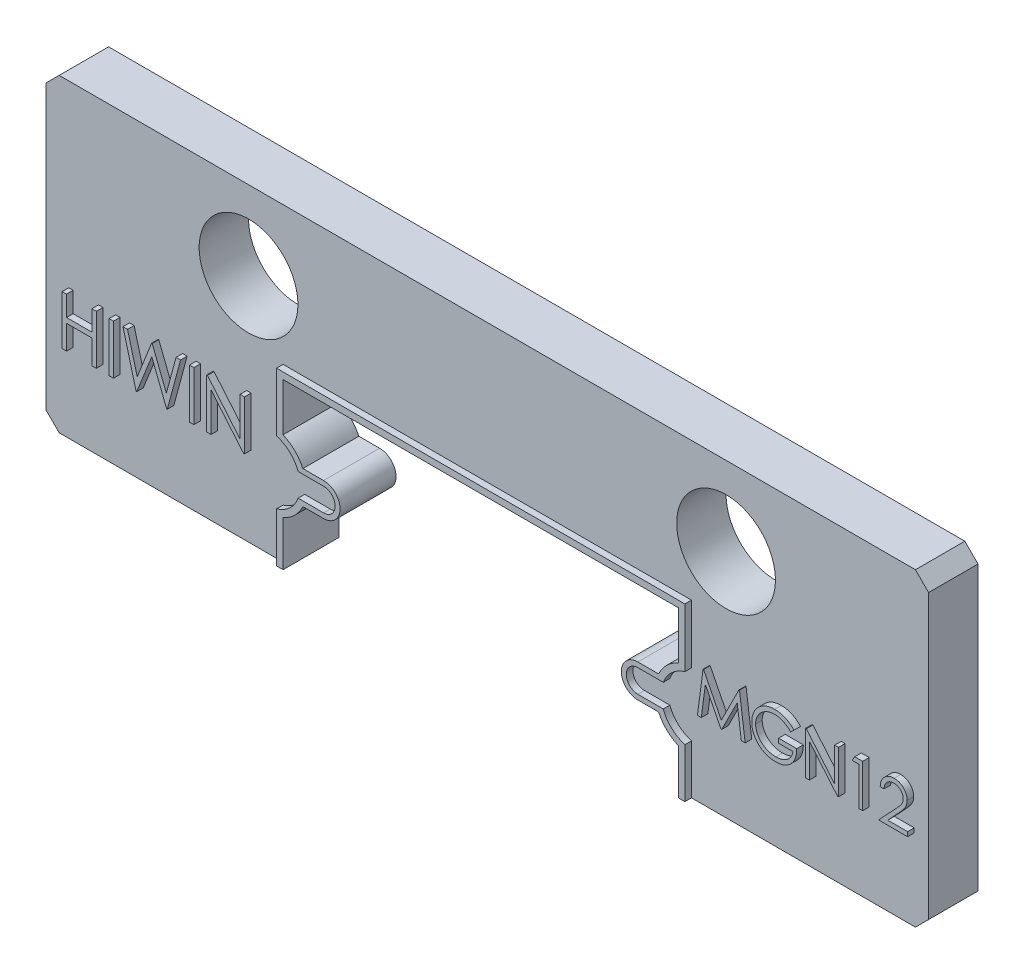
from build123d import *

# Parameters (mm, degrees)
BOSS_EXTRUDE1_DEPTH = 1.5
SKETCH2_R           = 1.5
CUT_EXTRUDE1_DEPTH  = 15.279355728
SKETCH3_W           = 0.134615385
SKETCH3_H           = 1.5
SKETCH3_W_2         = 0.134615384
BOSS_EXTRUDE2_DEPTH = 0.2
BOSS_EXTRUDE3_START = 0.2
BOSS_EXTRUDE3_DEPTH = 0.2


with BuildPart() as part:
    # Sketch1 → Boss-Extrude1 (new body)
    with BuildSketch(Plane.XY):
        with BuildLine():
            Line((-13, -4.7), (-6, -4.7))
            Line((-6, -4.7), (-6, -3.328898526))
            ThreePointArc((-6, -3.328898526), (-5.646338178, -3.089180762), (-5.400138898, -2.74))
            Line((-5.400138898, -2.74), (-4.77, -2.74))
            ThreePointArc((-4.77, -2.74), (-4.27, -2.24), (-4.77, -1.74))
            Line((-4.77, -1.74), (-5.400138898, -1.74))
            ThreePointArc((-5.400138898, -1.74), (-5.646338178, -1.390819238), (-6, -1.151101474))
            Line((-6, -1.151101474), (-6, 0.3))
            Line((-6, 0.3), (6, 0.3))
            Line((6, 0.3), (6, -1.151101474))
            ThreePointArc((6, -1.151101474), (5.646338178, -1.390819238), (5.400138898, -1.74))
            Line((5.400138898, -1.74), (4.77, -1.74))
            ThreePointArc((4.77, -1.74), (4.27, -2.24), (4.77, -2.74))
            Line((4.77, -2.74), (5.400138898, -2.74))
            ThreePointArc((5.400138898, -2.74), (5.646338178, -3.089180762), (6, -3.328898526))
            Line((6, -3.328898526), (6, -4.7))
            Line((6, -4.7), (13, -4.7))
            Line((13, -4.7), (13.4, -4.3))
            Line((13.4, -4.3), (13.4, 4.3))
            Line((13.4, 4.3), (13, 4.7))
            Line((13, 4.7), (-13, 4.7))
            Line((-13, 4.7), (-13.4, 4.3))
            Line((-13.4, 4.3), (-13.4, -4.3))
            Line((-13.4, -4.3), (-13, -4.7))
        make_face()
    extrude(amount=-BOSS_EXTRUDE1_DEPTH)

    # Sketch2 → Cut-Extrude1 (cut, through all)
    with BuildSketch(Plane.XY):
        with Locations((-7.25, 2.3)):
            Circle(SKETCH2_R)
        with Locations((7.25, 2.3)):
            Circle(SKETCH2_R)
    extrude(amount=-CUT_EXTRUDE1_DEPTH, mode=Mode.SUBTRACT)

    # Sketch3 → Boss-Extrude2 (add)
    with BuildSketch(Plane.XY):
        Polygon((-8.324615385, -2.24), (-8.324615385, -0.74), (-8.296370192, -0.74), (-7.305384615, -1.920588942), (-7.305384615, -0.74), (-7.170769231, -0.74), (-7.170769231, -2.24), (-7.201418269, -2.24), (-8.19, -1.062115385), (-8.19, -2.24), align=None)
        with Locations((-8.776538462, -1.49)):
            Rectangle(SKETCH3_W, SKETCH3_H)
        Polygon((-10.863076923, -0.74), (-10.723954327, -0.74), (-10.430384615, -1.840060096), (-9.993786058, -0.74), (-9.974254808, -0.74), (-9.545769231, -1.832548077), (-9.250697115, -0.74), (-9.113076923, -0.74), (-9.517524038, -2.24), (-9.536754808, -2.24), (-9.988076923, -1.092764423), (-10.444807692, -2.24), (-10.464038462, -2.24), align=None)
        with Locations((-11.218846154, -1.49)):
            Rectangle(SKETCH3_W_2, SKETCH3_H)
        Polygon((-12.709230769, -0.74), (-12.574615385, -0.74), (-12.574615385, -1.355384615), (-11.805384615, -1.355384615), (-11.805384615, -0.74), (-11.670769231, -0.74), (-11.670769231, -2.24), (-11.805384615, -2.24), (-11.805384615, -1.509230769), (-12.574615385, -1.509230769), (-12.574615385, -2.24), (-12.709230769, -2.24), align=None)
        Polygon((6.58, -2.24), (6.751614583, -0.94), (6.76828125, -0.94), (7.305, -2.006666667), (7.840416667, -0.94), (7.85734375, -0.94), (8.03, -2.24), (7.9128125, -2.24), (7.788333333, -1.304583333), (7.3190625, -2.24), (7.292760417, -2.24), (6.821666667, -1.3025), (6.697447917, -2.24), align=None)
        with BuildLine():
            Line((9.513333333, -1.161875), (9.413333333, -1.256666667))
            add(Edge.make_bspline(
                [(9.413333333, -1.256666667), (9.395237746, -1.239643775), (9.359478072, -1.206003911), (9.301178553, -1.16235697), (9.240352061, -1.124966704), (9.17731599, -1.094544388), (9.113631385, -1.070270506), (9.050143553, -1.052988625), (8.987503721, -1.041967397), (8.945841612, -1.040649431), (8.9253125, -1.04)],
                knots=[0, 0, 0, 0, 1.08915593, 2.152340314, 3.188132944, 4.216796309, 5.218260357, 6.173443236, 7.099959455, 8, 8, 8, 8], degree=3))
            add(Edge.make_bspline(
                [(8.9253125, -1.04), (8.912715611, -1.040153625), (8.887554505, -1.040460477), (8.85018064, -1.0443769), (8.813198746, -1.050009563), (8.776678636, -1.058159404), (8.740549301, -1.068488483), (8.704936398, -1.081408798), (8.669773495, -1.096472174), (8.635391807, -1.113878236), (8.60205962, -1.132999322), (8.57057851, -1.15418878), (8.540747819, -1.176767473), (8.513128232, -1.201300694), (8.487560877, -1.227566215), (8.463437196, -1.255075443), (8.441605629, -1.284579953), (8.421886054, -1.3155369), (8.404294596, -1.34740257), (8.388765667, -1.379870252), (8.375729606, -1.412832255), (8.365415237, -1.446329941), (8.356905565, -1.48010416), (8.350919025, -1.514388771), (8.347543957, -1.549220482), (8.346960153, -1.572545178), (8.346666667, -1.584270833)],
                knots=[0, 0, 0, 0, 1.02818874, 2.053710826, 3.065248034, 4.081641283, 5.106893873, 6.131558223, 7.173050175, 8.228653731, 9.27666206, 10.308777013, 11.325269123, 12.329503258, 13.32196095, 14.316845687, 15.314881793, 16.315733098, 17.311955233, 18.285320748, 19.252783886, 20.203351036, 21.145449891, 22.095197417, 23.042428769, 24, 24, 24, 24], degree=3))
            add(Edge.make_bspline(
                [(8.346666667, -1.584270833), (8.346947362, -1.596257137), (8.347507986, -1.620197013), (8.351096105, -1.65592624), (8.357755166, -1.691124818), (8.366657458, -1.725908411), (8.377793189, -1.760336588), (8.391674465, -1.794260092), (8.408115974, -1.827677666), (8.427146693, -1.860288209), (8.448015854, -1.892053904), (8.471394713, -1.921976012), (8.496228644, -1.950452986), (8.523422378, -1.976852556), (8.552103923, -2.00188086), (8.583130197, -2.02484834), (8.61589111, -2.046197394), (8.650436646, -2.065658958), (8.686391965, -2.083044986), (8.723258759, -2.09850529), (8.761154805, -2.111237615), (8.799880947, -2.121614625), (8.839391019, -2.13012045), (8.879885575, -2.135592514), (8.921066866, -2.139563394), (8.94882693, -2.139853729), (8.9628125, -2.14)],
                knots=[0, 0, 0, 0, 0.93586088, 1.869166235, 2.799637598, 3.729985548, 4.670839027, 5.622275134, 6.589130586, 7.576015415, 8.568469353, 9.55398029, 10.53834874, 11.515998671, 12.510579167, 13.508179873, 14.527009472, 15.561807829, 16.601455013, 17.643573243, 18.680854198, 19.719860599, 20.772568776, 21.833555941, 22.908541556, 24, 24, 24, 24], degree=3))
            add(Edge.make_bspline(
                [(8.9628125, -2.14), (8.979667315, -2.139647672), (9.012764482, -2.138955818), (9.061416589, -2.133569996), (9.108143444, -2.12515833), (9.152813748, -2.112839568), (9.195479384, -2.097126775), (9.236296762, -2.078185631), (9.274944521, -2.055289638), (9.311538843, -2.029447916), (9.345248655, -2.000656692), (9.375651615, -1.969588752), (9.402262797, -1.936394898), (9.425478828, -1.901270638), (9.444684899, -1.863925239), (9.460449366, -1.824541716), (9.47253316, -1.783102354), (9.477493579, -1.75446832), (9.48, -1.74)],
                knots=[0, 0, 0, 0, 1.13008108, 2.219097802, 3.278683437, 4.311054135, 5.322181354, 6.324827112, 7.324222904, 8.330512327, 9.32562643, 10.293043162, 11.24128371, 12.174520618, 13.111833804, 14.052305215, 15.015860969, 16, 16, 16, 16], degree=3))
            Line((9.48, -1.74), (9.046666667, -1.74))
            Line((9.046666667, -1.74), (9.046666667, -1.606666667))
            Line((9.046666667, -1.606666667), (9.596666667, -1.606666667))
            add(Edge.make_bspline(
                [(9.596666667, -1.606666667), (9.596033066, -1.63151802), (9.594792995, -1.680156607), (9.58609454, -1.751088421), (9.572048407, -1.818083622), (9.552860291, -1.881212763), (9.528020901, -1.940386383), (9.497796819, -1.995664562), (9.461704317, -2.046690186), (9.42102901, -2.093879816), (9.375380455, -2.135973523), (9.32599211, -2.172970015), (9.272782379, -2.204133843), (9.215801593, -2.229487804), (9.15523629, -2.249275287), (9.09094632, -2.26330473), (9.023018868, -2.271710145), (8.976465245, -2.272784086), (8.95265625, -2.273333333)],
                knots=[0, 0, 0, 0, 1.140356446, 2.231883559, 3.274166699, 4.278491846, 5.25512956, 6.21435461, 7.1637429, 8.11826594, 9.068280886, 10.0076534, 10.945064095, 11.891975133, 12.864533718, 13.863980011, 14.907571808, 16, 16, 16, 16], degree=3))
            add(Edge.make_bspline(
                [(8.95265625, -2.273333333), (8.937981057, -2.273121945), (8.909036846, -2.27270502), (8.866288787, -2.269742006), (8.824719385, -2.265180649), (8.784334696, -2.25829246), (8.744986169, -2.249855588), (8.706870323, -2.23905195), (8.669841962, -2.226546433), (8.633843853, -2.212322326), (8.599202736, -2.195841425), (8.565764315, -2.177526416), (8.533343754, -2.157471739), (8.502161893, -2.135330568), (8.472056262, -2.111268511), (8.443220983, -2.085237341), (8.415494628, -2.05731664), (8.398126456, -2.03749015), (8.389375, -2.0275)],
                knots=[0, 0, 0, 0, 1.107784379, 2.184907829, 3.233506516, 4.263428166, 5.276301166, 6.270063455, 7.25232949, 8.225834625, 9.190232166, 10.146266622, 11.1027726, 12.066435141, 13.031522626, 14.010570082, 14.99756817, 16, 16, 16, 16], degree=3))
            add(Edge.make_bspline(
                [(8.389375, -2.0275), (8.376677368, -2.0116509), (8.351492872, -1.98021578), (8.319075271, -1.929850086), (8.291440464, -1.877700824), (8.26901813, -1.823622819), (8.251509698, -1.767666654), (8.23895309, -1.709903832), (8.231596097, -1.650259969), (8.230536212, -1.609898585), (8.23, -1.589479167)],
                knots=[0, 0, 0, 0, 1.023165419, 2.029347347, 3.013907458, 3.994755782, 4.975994455, 5.96558838, 6.970761222, 8, 8, 8, 8], degree=3))
            add(Edge.make_bspline(
                [(8.23, -1.589479167), (8.230197688, -1.574188844), (8.230590553, -1.54380253), (8.235354316, -1.498689816), (8.242189128, -1.45437813), (8.252235177, -1.410903695), (8.264899504, -1.368237475), (8.280705085, -1.32635966), (8.299107475, -1.285245536), (8.320496373, -1.2451781), (8.344299172, -1.206689032), (8.370132111, -1.169933276), (8.39836202, -1.135580195), (8.428527888, -1.103194726), (8.460989628, -1.073183726), (8.495443128, -1.045269342), (8.531914941, -1.01941413), (8.570519808, -0.996025334), (8.610681519, -0.975015989), (8.652303805, -0.956597139), (8.695373961, -0.941374765), (8.73956931, -0.92845879), (8.785224381, -0.918907452), (8.832007867, -0.911980775), (8.880163622, -0.907241123), (8.912714148, -0.906859943), (8.92921875, -0.906666667)],
                knots=[0, 0, 0, 0, 1.008945113, 2.00506715, 2.99143336, 3.967273523, 4.948097931, 5.927297278, 6.919902385, 7.919676788, 8.923139349, 9.905703106, 10.883022732, 11.856032218, 12.825136022, 13.798837087, 14.781400844, 15.773989409, 16.776158564, 17.77167057, 18.775803737, 19.789618931, 20.80898985, 21.851988756, 22.910860228, 24, 24, 24, 24], degree=3))
            add(Edge.make_bspline(
                [(8.92921875, -0.906666667), (8.942678669, -0.906881906), (8.969368107, -0.907308702), (9.009083379, -0.910267), (9.048184784, -0.91495587), (9.086730301, -0.92135439), (9.124588665, -0.930069475), (9.161867727, -0.940498553), (9.198621526, -0.95264123), (9.234734876, -0.967122801), (9.270450599, -0.983559862), (9.305967283, -1.00206199), (9.341163574, -1.022945563), (9.37610051, -1.046272591), (9.4109984, -1.071642432), (9.445305267, -1.09978068), (9.479849218, -1.129577704), (9.50206132, -1.151002515), (9.513333333, -1.161875)],
                knots=[0, 0, 0, 0, 0.985871117, 1.954866573, 2.915460327, 3.869826059, 4.81536089, 5.759505086, 6.70452669, 7.649098992, 8.607881297, 9.583363685, 10.581137262, 11.603961102, 12.659522466, 13.73993555, 14.853081303, 16, 16, 16, 16], degree=3))
        make_face()
        Polygon((9.863333333, -2.24), (9.863333333, -0.94), (9.8878125, -0.94), (10.746666667, -1.963177083), (10.746666667, -0.94), (10.863333333, -0.94), (10.863333333, -2.24), (10.836770833, -2.24), (9.98, -1.219166667), (9.98, -2.24), align=None)
        Polygon((11.356302083, -0.94), (11.596666667, -0.94), (11.596666667, -2.24), (11.48, -2.24), (11.48, -1.073333333), (11.28, -1.073333333), align=None)
        with BuildLine():
            Line((12.246666667, -1.34), (12.13, -1.34))
            add(Edge.make_bspline(
                [(12.13, -1.34), (12.130760371, -1.324522242), (12.13225372, -1.294124336), (12.139247084, -1.249804028), (12.149253696, -1.207440817), (12.16340195, -1.167374849), (12.180972853, -1.129251864), (12.202044006, -1.093223286), (12.227001722, -1.059426559), (12.255307081, -1.028174989), (12.286049718, -0.99950532), (12.319220496, -0.974747658), (12.35407722, -0.953829666), (12.39051414, -0.936342347), (12.428942349, -0.923216119), (12.469013125, -0.913476653), (12.510902518, -0.907616867), (12.539443098, -0.906987004), (12.553958333, -0.906666667)],
                knots=[0, 0, 0, 0, 1.10065271, 2.161652631, 3.183658789, 4.190468796, 5.17591951, 6.163126047, 7.15150782, 8.156236427, 9.156009102, 10.134482811, 11.092018607, 12.041330605, 13.001268258, 13.972401359, 14.968799086, 16, 16, 16, 16], degree=3))
            add(Edge.make_bspline(
                [(12.553958333, -0.906666667), (12.568213047, -0.907000379), (12.596223049, -0.907656112), (12.637103226, -0.913287351), (12.676020506, -0.922107143), (12.71289882, -0.93448144), (12.747443929, -0.951115656), (12.779915346, -0.971097599), (12.810699647, -0.994207822), (12.838410738, -1.021416381), (12.863856596, -1.050462981), (12.885808862, -1.081472774), (12.904608037, -1.113500794), (12.920277747, -1.146791269), (12.931812884, -1.181657651), (12.940570505, -1.217592327), (12.945520687, -1.254967256), (12.946280415, -1.280263977), (12.946666667, -1.293125)],
                knots=[0, 0, 0, 0, 1.111607364, 2.184268762, 3.212621178, 4.221274766, 5.211760367, 6.196651075, 7.1921475, 8.207485113, 9.220403448, 10.201281604, 11.166441695, 12.114753415, 13.065576456, 14.026450734, 14.996634279, 16, 16, 16, 16], degree=3))
            add(Edge.make_bspline(
                [(12.946666667, -1.293125), (12.94603774, -1.311231339), (12.944790925, -1.347126275), (12.934125585, -1.399874653), (12.917468309, -1.45098078), (12.897412148, -1.492111778), (12.877179526, -1.525255647), (12.858947023, -1.552544023), (12.837602951, -1.581926054), (12.812836651, -1.613303351), (12.785160442, -1.646921687), (12.754323638, -1.682760754), (12.720106345, -1.720450268), (12.69609033, -1.746192349), (12.683645833, -1.75953125)],
                knots=[0, 0, 0, 0, 1.184426356, 2.348067706, 3.509069118, 4.696110526, 5.333549288, 6.050745305, 6.844228056, 7.710549037, 8.667450064, 9.695053472, 10.805634456, 12, 12, 12, 12], degree=3))
            Line((12.683645833, -1.75953125), (12.358385417, -2.106666667))
            Line((12.358385417, -2.106666667), (12.963333333, -2.106666667))
            Line((12.963333333, -2.106666667), (12.963333333, -2.24))
            Line((12.963333333, -2.24), (12.08, -2.24))
            Line((12.08, -2.24), (12.584166667, -1.701979167))
            add(Edge.make_bspline(
                [(12.584166667, -1.701979167), (12.596441596, -1.68916551), (12.620019223, -1.664553098), (12.653367038, -1.628619998), (12.683318662, -1.595284455), (12.710067979, -1.564609451), (12.73303471, -1.536146297), (12.753415824, -1.510816836), (12.769745901, -1.48750804), (12.787468762, -1.460490098), (12.804633955, -1.427502666), (12.819384259, -1.387190152), (12.828378346, -1.345691459), (12.829457284, -1.317647845), (12.83, -1.303541667)],
                knots=[0, 0, 0, 0, 1.329631726, 2.553950428, 3.673215718, 4.687767853, 5.603093632, 6.413772471, 7.123043292, 7.734684054, 8.834405432, 9.900288307, 10.943827018, 12, 12, 12, 12], degree=3))
            add(Edge.make_bspline(
                [(12.83, -1.303541667), (12.829763867, -1.294671433), (12.829298495, -1.277189906), (12.82519135, -1.251559195), (12.81898459, -1.226835121), (12.810090637, -1.202941634), (12.798350991, -1.180118964), (12.784060879, -1.158339328), (12.767573141, -1.137283427), (12.748499812, -1.117540773), (12.727546962, -1.099459183), (12.705411955, -1.083441665), (12.681993345, -1.07005571), (12.657389871, -1.059082411), (12.631670125, -1.050474412), (12.604784363, -1.044509797), (12.576806871, -1.040764874), (12.557703001, -1.040258182), (12.54796875, -1.04)],
                knots=[0, 0, 0, 0, 0.991446411, 1.95395049, 2.89581595, 3.838931463, 4.798493298, 5.75982156, 6.748411868, 7.785213223, 8.824556874, 9.840280684, 10.836137867, 11.835679398, 12.848801643, 13.863922112, 14.911575587, 16, 16, 16, 16], degree=3))
            add(Edge.make_bspline(
                [(12.54796875, -1.04), (12.537802441, -1.040265583), (12.517837488, -1.040787145), (12.488524704, -1.044435563), (12.460561415, -1.050729733), (12.43387728, -1.059338212), (12.408427148, -1.070279958), (12.384334789, -1.083908321), (12.361654287, -1.100170761), (12.340343007, -1.118608682), (12.320707815, -1.139136648), (12.303456118, -1.162020349), (12.288382056, -1.18684196), (12.275230055, -1.213534508), (12.26454937, -1.242340197), (12.256387914, -1.273156773), (12.249929942, -1.305850429), (12.247772492, -1.328427747), (12.246666667, -1.34)],
                knots=[0, 0, 0, 0, 1.031018746, 2.02475058, 2.990194455, 3.934040569, 4.864654155, 5.795059489, 6.735614925, 7.690564532, 8.649604399, 9.611025574, 10.590972636, 11.591080095, 12.624614302, 13.701020113, 14.821632451, 16, 16, 16, 16], degree=3))
        make_face()
    extrude(amount=BOSS_EXTRUDE2_DEPTH)

    # Sketch4 → Boss-Extrude3 (add)
    with BuildSketch(Plane.XY.offset(BOSS_EXTRUDE3_START)):
        with BuildLine():
            Line((-6.2, -4.7), (-6.2, -3.2))
            ThreePointArc((-6.2, -3.2), (-5.799452457, -2.972703925), (-5.5432503, -2.59))
            Line((-5.5432503, -2.59), (-4.77, -2.59))
            ThreePointArc((-4.77, -2.59), (-4.42, -2.24), (-4.77, -1.89))
            Line((-4.77, -1.89), (-5.5432503, -1.89))
            ThreePointArc((-5.5432503, -1.89), (-5.799452457, -1.507296075), (-6.2, -1.28))
            Line((-6.2, -1.28), (-6.2, 0.5))
            Line((-6.2, 0.5), (6.2, 0.5))
            Line((6.2, 0.5), (6.2, -1.28))
            ThreePointArc((6.2, -1.28), (5.799452457, -1.507296075), (5.5432503, -1.89))
            Line((5.5432503, -1.89), (4.77, -1.89))
            ThreePointArc((4.77, -1.89), (4.42, -2.24), (4.77, -2.59))
            Line((4.77, -2.59), (5.5432503, -2.59))
            ThreePointArc((5.5432503, -2.59), (5.799452457, -2.972703925), (6.2, -3.2))
            Line((6.2, -3.2), (6.2, -4.7))
            Line((6.2, -4.7), (6, -4.7))
            Line((6, -4.7), (6, -3.328898526))
            ThreePointArc((6, -3.328898526), (5.646338178, -3.089180762), (5.400138898, -2.74))
            Line((5.400138898, -2.74), (4.77, -2.74))
            ThreePointArc((4.77, -2.74), (4.27, -2.24), (4.77, -1.74))
            Line((4.77, -1.74), (5.400138898, -1.74))
            ThreePointArc((5.400138898, -1.74), (5.646338178, -1.390819238), (6, -1.151101474))
            Line((6, -1.151101474), (6, 0.3))
            Line((6, 0.3), (-6, 0.3))
            Line((-6, 0.3), (-6, -1.151101474))
            ThreePointArc((-6, -1.151101474), (-5.646338178, -1.390819238), (-5.400138898, -1.74))
            Line((-5.400138898, -1.74), (-4.77, -1.74))
            ThreePointArc((-4.77, -1.74), (-4.27, -2.24), (-4.77, -2.74))
            Line((-4.77, -2.74), (-5.400138898, -2.74))
            ThreePointArc((-5.400138898, -2.74), (-5.646338178, -3.089180762), (-6, -3.328898526))
            Line((-6, -3.328898526), (-6, -4.7))
            Line((-6, -4.7), (-6.2, -4.7))
        make_face()
    extrude(amount=-BOSS_EXTRUDE3_DEPTH)


solid = part.part
